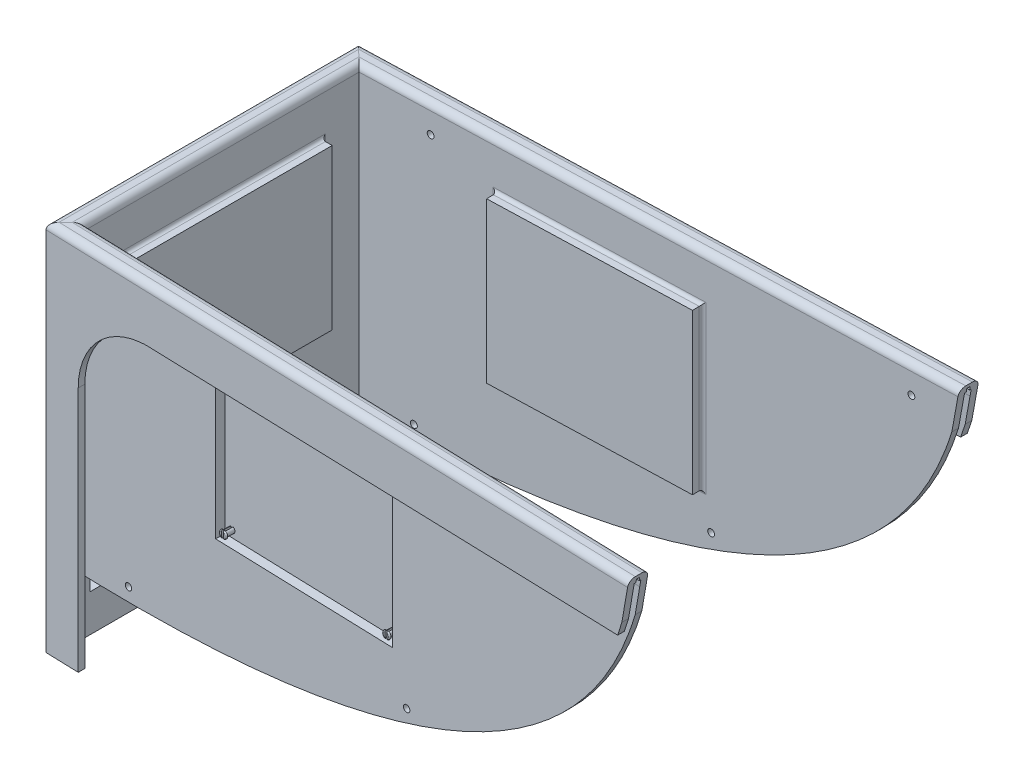
from build123d import *

# Parameters (mm, degrees)
FILETE2_R                   = 10
ESBO_O9_W                   = 300
ESBO_O9_H                   = 240
RESSALTO_EXTRUS_O3_DEPTH    = 15.25
FILETE5_R                   = 5
ESBO_O14_W                  = 300
ESBO_O14_H                  = 240
RESSALTO_EXTRUS_O4_DEPTH    = 15.25
ESBO_O15_W                  = 275
ESBO_O15_H                  = 214
CORTE_EXTRUS_O7_DEPTH       = 14
FILETE6_R                   = 5
ESBO_O10_W                  = 275
ESBO_O10_H                  = 214
CORTE_EXTRUS_O9_DEPTH       = 14
RESSALTO_EXTRUS_O5_DEPTH    = 480
FILETE7_R                   = 30
FILETE8_R                   = 110
ESBO_O18_W                  = 10
ESBO_O18_H                  = 50
RESSALTO_EXTRUS_O6_DEPTH    = 369.378390867
ESBO_O20_W                  = 300
ESBO_O20_H                  = 240
RESSALTO_EXTRUS_O7_DEPTH    = 15.25
ESBO_O19_W                  = 275
ESBO_O19_H                  = 214
CORTE_EXTRUS_O10_DEPTH      = 14
FILETE9_R                   = 5
CORTE_EXTRUS_O11_DEPTH      = 1125.95429238
CORTE_EXTRUS_O11_DEPTH_BACK = 1125.95429238
ESBO_O26_W                  = 79.384198275
ESBO_O26_H                  = 369.364957754
RESSALTO_EXTRUS_O11_DEPTH   = 58
CORTE_EXTRUS_O13_DEPTH      = 1036.72468391
CASCA5_START                = -484
CASCA5_DEPTH                = 46
CORTE_EXTRUS_O14_START      = -58
ESBO_O29_W                  = 24.384198275
ESBO_O29_H                  = 369.364957754
CORTE_EXTRUS_O14_DEPTH      = 58
ESBO_O31_W                  = 0.046067228
ESBO_O31_H                  = 369.364957754
RESSALTO_EXTRUS_O12_DEPTH   = 40
ESBO_O32_R                  = 8
CORTE_EXTRUS_O15_DEPTH      = 1119.047561812
ESBO_O35_R                  = 8
CORTE_EXTRUS_O17_DEPTH      = 40
ESBO_O41_R                  = 8
CORTE_EXTRUS_O19_DEPTH      = 1171.169791695
ESBO_O40_R                  = 8
CORTE_EXTRUS_O20_DEPTH      = 1120.776870047
ESBO_O39_R                  = 8
CORTE_EXTRUS_O21_DEPTH      = 1121.170482418
ESBO_O37_R                  = 8
CORTE_EXTRUS_O22_DEPTH      = 1120.7776345
ESBO_O38_R                  = 8
CORTE_EXTRUS_O23_DEPTH      = 1121.171300703
ESBO_O43_R                  = 4.5
RESSALTO_EXTRUS_O13_DEPTH   = 12
ESBO_O45_R                  = 6
RESSALTO_EXTRUS_O14_DEPTH   = 2
FILETE16_R                  = 2
CORTE_EXTRUS_O24_REACH      = 1155.853
ESBO_O46_W                  = 3
ESBO_O46_H                  = 16.786110424
ESBO_O46_H_2                = 18.249198164
ESBO_O47_R                  = 4.5
RESSALTO_EXTRUS_O15_DEPTH   = 12
ESBO_O48_R                  = 6
RESSALTO_EXTRUS_O16_DEPTH   = 2
FILETE17_R                  = 2
ESBO_O49_W                  = 3
ESBO_O49_H                  = 16.746916968
ESBO_O49_H_2                = 19.143752138
CORTE_EXTRUS_O25_DEPTH      = 14
ESBO_O50_R                  = 4.5
RESSALTO_EXTRUS_O17_DEPTH   = 12
ESBO_O51_R                  = 6
RESSALTO_EXTRUS_O18_DEPTH   = 2
FILETE18_R                  = 2
CORTE_EXTRUS_O26_REACH      = 1155.853
ESBO_O52_W                  = 3
ESBO_O52_H                  = 16.045822922
ESBO_O52_H_2                = 14.769055064
ESBO_O53_R                  = 4.5
RESSALTO_EXTRUS_O19_DEPTH   = 12
ESBO_O54_R                  = 6
RESSALTO_EXTRUS_O20_DEPTH   = 2
FILETE19_R                  = 2
CORTE_EXTRUS_O27_REACH      = 1070.757
ESBO_O55_W                  = 3
ESBO_O55_H                  = 18.155230036
ESBO_O55_H_2                = 15.630150612
ESBO_O55_H_3                = 14.353148996
ESBO_O55_H_4                = 16.995204258
ESBO_O59_W                  = 369.364957754
ESBO_O59_H                  = 40
CORTE_EXTRUS_O30_DEPTH      = 10
ESBO_O61_W                  = 10
ESBO_O61_H                  = 70
RESSALTO_EXTRUS_O22_DEPTH   = 369.378390867
FILETE23_R                  = 30
FILETE24_R                  = 30
CUT_EXTRUDE3_DEPTH          = 40
CUT_EXTRUDE3_DEPTH_BACK     = 25
SKETCH4_R                   = 5
CUT_EXTRUDE4_DEPTH          = 25
CUT_EXTRUDE4_DEPTH_BACK     = 25
SKETCH5_R                   = 5
SKETCH6_R                   = 5
CUT_EXTRUDE5_DEPTH          = 25


with BuildPart() as part:
    # Varredura2: sweep along a path in Esboço1
    with BuildLine(Plane(origin=(0, 0, 0), x_dir=(1, 0, 0), z_dir=(0, 1, 0))) as varredura2_path:
        Line((950, 255), (0, 225))
        Line((0, 225), (0, -225))
        Line((0, -225), (950, -255))
    # Esboço2 → Varredura2 (sweep)
    with BuildSketch(Plane.XY):
        Polygon((10, 0), (10, -430), (20, -430), (20, 20), (-10, 20), (-10, -60), (0, -60), (0, 0), (0, 10), (2.5, 10), (2.5, 15), (7.5, 15), (7.5, 10), (10, 10), align=None)
    sweep(path=varredura2_path.line, transition=Transition.RIGHT)

    # Filete2
    filete2_edges = [part.edges().sort_by_distance(p)[0] for p in [
        (20, 20, 0),
        (-10, 20, 0),
        (485.315632134, 20, 220.31578699),
        (485.315632134, 20, -220.31578699),
        (469.842183933, 20, -249.842106505),
        (469.842183933, 20, 249.842106505),
    ]]
    fillet(filete2_edges, radius=FILETE2_R)

    # Esboço9 → Ressalto-extrusão3 (add)
    with BuildSketch(Plane(origin=(-6.466920368, 0, 204.785811648), x_dir=(-0.9995017576572264, 0, -0.03156321339970188), z_dir=(0.03156321339970188, 0, -0.9995017576572264))):
        with Locations((-376.790918448, -170)):
            Rectangle(ESBO_O9_W, ESBO_O9_H)
    extrude(amount=RESSALTO_EXTRUS_O3_DEPTH)

    # Filete5
    filete5_edges = [part.edges().sort_by_distance(p)[0] for p in [
        (220.211001242, -170, 211.944061804),
        (370.136264891, -50, 216.678543814),
        (520.061528539, -170, 221.413025824),
        (370.136264891, -290, 216.678543814),
    ]]
    fillet(filete5_edges, radius=FILETE5_R)

    # Esboço14 → Ressalto-extrusão4 (add)
    with BuildSketch(Plane(origin=(-6.466920368, 0, -204.785811648), x_dir=(0.9995017576572264, 0, -0.03156321339970189), z_dir=(0.03156321339970189, 0, 0.9995017576572264))):
        with Locations((376.790918448, -170)):
            Rectangle(ESBO_O14_W, ESBO_O14_H)
    extrude(amount=RESSALTO_EXTRUS_O4_DEPTH)

    # Esboço15 → Corte-extrusão7 (cut)
    with BuildSketch(Plane(origin=(-6.782552502, 0, -214.780829224), x_dir=(-0.9995017576572264, 0, 0.03156321339970189), z_dir=(-0.03156321339970189, 0, -0.9995017576572264))):
        with Locations((-376.790918448, -170)):
            Rectangle(ESBO_O15_W, ESBO_O15_H)
    extrude(amount=-CORTE_EXTRUS_O7_DEPTH, mode=Mode.SUBTRACT)

    # Filete6
    filete6_edges = [part.edges().sort_by_distance(p)[0] for p in [
        (520.061528539, -170, -221.413025824),
        (370.136264891, -50, -216.678543814),
        (220.211001242, -170, -211.944061804),
        (370.136264891, -290, -216.678543814),
    ]]
    fillet(filete6_edges, radius=FILETE6_R)

    # Esboço10 → Corte-extrusão9 (cut)
    with BuildSketch(Plane(origin=(-6.782552502, 0, 214.780829224), x_dir=(0.9995017576572264, 0, 0.03156321339970188), z_dir=(-0.03156321339970188, 0, 0.9995017576572264))):
        with Locations((376.790918448, -170)):
            Rectangle(ESBO_O10_W, ESBO_O10_H)
    extrude(amount=-CORTE_EXTRUS_O9_DEPTH, mode=Mode.SUBTRACT)

    # Esboço17 → Ressalto-extrusão5 (add)
    with BuildSketch(Plane.XZ.offset(60)):
        Polygon((40, 236.268142802), (40, 226.263157895), (0, 225), (0, 184.689195433), (-10, 184.689195433), (-10, 234.689195433), align=None)
        Polygon((-10, -184.689195433), (-10, -234.689195433), (40, -236.268142802), (40, -226.263157895), (0, -225), (0, -184.689195433), align=None)
    extrude(amount=RESSALTO_EXTRUS_O5_DEPTH)

    # Filete7
    filete7_edges = [part.edges().sort_by_distance(p)[0] for p in [
        (-5, -60, 184.689195433),
        (-5, -60, -184.689195433),
    ]]
    fillet(filete7_edges, radius=FILETE7_R)

    # Filete8
    filete8_edges = [part.edges().sort_by_distance(p)[0] for p in [
        (40, -60, 231.265650348),
        (40, -60, -231.265650348),
    ]]
    fillet(filete8_edges, radius=FILETE8_R)

    # Esboço18 → Ressalto-extrusão6 (add)
    with BuildSketch(Plane(origin=(0, 0, 184.689195433), x_dir=(-1, 0, 0), z_dir=(0, 0, -1))):
        with Locations((5, -515)):
            Rectangle(ESBO_O18_W, ESBO_O18_H)
    extrude(amount=RESSALTO_EXTRUS_O6_DEPTH)

    # Esboço20 → Ressalto-extrusão7 (add)
    with BuildSketch(Plane(origin=(20, 0, 0), x_dir=(0, 0, -1), z_dir=(1, 0, 0))):
        with Locations((0, -170)):
            Rectangle(ESBO_O20_W, ESBO_O20_H)
    extrude(amount=RESSALTO_EXTRUS_O7_DEPTH)

    # Esboço19 → Corte-extrusão10 (cut)
    with BuildSketch(Plane.ZY.offset(-10)):
        with Locations((0, -170)):
            Rectangle(ESBO_O19_W, ESBO_O19_H)
    extrude(amount=-CORTE_EXTRUS_O10_DEPTH, mode=Mode.SUBTRACT)

    # Filete9
    filete9_edges = [part.edges().sort_by_distance(p)[0] for p in [
        (20, -170, -150),
        (20, -50, 0),
        (20, -170, 150),
        (20, -290, 0),
    ]]
    fillet(filete9_edges, radius=FILETE9_R)

    # Esboço21 → Corte-extrusão11 (cut, two sides: drawn at the far end of the back side and taken through both)
    with BuildSketch(Plane.XY.offset(-CORTE_EXTRUS_O11_DEPTH_BACK)):
        with BuildLine():
            Line((956.934998993, 377.169250079), (1160.857153911, 377.169250079))
            Line((1160.857153911, 377.169250079), (1160.857153911, -557.721657685))
            Line((1160.857153911, -557.721657685), (47.737792571, -557.721657685))
            Line((47.737792571, -557.721657685), (47.737792571, -430))
            add(Edge.make_bspline(
                [(47.737792571, -430), (766.687909368, -424.265370751), (883.376804682, -40)],
                knots=[0, 0, 0, 0.856241292, 0.856241292, 0.856241292], degree=2))
            Line((883.376804682, -40), (956.934998993, 377.169250079))
        make_face()
    extrude(amount=CORTE_EXTRUS_O11_DEPTH + CORTE_EXTRUS_O11_DEPTH_BACK, mode=Mode.SUBTRACT)

    # Esboço26 → Ressalto-extrusão11 (add)
    with BuildSketch(Plane(origin=(0, -490, 0), x_dir=(1, 0, 0), z_dir=(0, 1, 0))):
        with Locations((-15.307900862, -0.006716556)):
            Rectangle(ESBO_O26_W, ESBO_O26_H)
    extrude(amount=RESSALTO_EXTRUS_O11_DEPTH)

    # Esboço27 → Corte-extrusão13 (cut, through all)
    with BuildSketch(Plane(origin=(0, -432, 0), x_dir=(1, 0, 0), z_dir=(0, 1, 0))):
        Polygon((-55, 184.675762321), (-55, 24.993283444), (-50.186320514, 92.617350681), (-46.866252377, 142.507000385), (-20, 184.675762321), align=None)
        Polygon((-55, -184.689195433), (-20, -184.689195433), (-46.866252377, -142.520433498), (-50.186320514, -92.630783794), (-55, -25.006716556), align=None)
    extrude(amount=-CORTE_EXTRUS_O13_DEPTH, mode=Mode.SUBTRACT)

    # Casca5: read off the stored shape, not the designer's step
    # Casca5 outline → Casca5 (cut)
    with BuildSketch(Plane(origin=(0, 0, 0), x_dir=(1, 0, 0), z_dir=(0, 1, 0)).offset(CASCA5_START)):
        Polygon((24.384198275, 178.675762321), (-16.708405005, 178.675762321), (-40.981397022, 140.577332832), (-44.200481443, 92.205134579), (-49, 24.780004473), (-49, -24.793437586), (-44.200481443, -92.218567692), (-40.981397022, -140.590765945), (-16.708405005, -178.689195433), (24.384198275, -178.689195433), align=None)
    extrude(amount=CASCA5_DEPTH, mode=Mode.SUBTRACT)

    # Esboço29 → Corte-extrusão14 (cut)
    with BuildSketch(Plane.XZ.offset(490).offset(CORTE_EXTRUS_O14_START)):
        with Locations((12.192099138, 0.006716556)):
            Rectangle(ESBO_O29_W, ESBO_O29_H)
    extrude(amount=CORTE_EXTRUS_O14_DEPTH, mode=Mode.SUBTRACT)

    # Esboço31 → Ressalto-extrusão12 (add)
    with BuildSketch(Plane(origin=(0, -432, 0), x_dir=(1, 0, 0), z_dir=(0, 1, 0))):
        with Locations((-9.976966386, -0.006716556)):
            Rectangle(ESBO_O31_W, ESBO_O31_H)
    extrude(amount=RESSALTO_EXTRUS_O12_DEPTH)

    # Esboço32 → Corte-extrusão15 (cut, through all)
    with BuildSketch(Plane(origin=(-49, 0, 0), x_dir=(0, 0, -1), z_dir=(1, 0, 0))):
        with Locations((-13.581716556, -461)):
            Circle(ESBO_O32_R)
        with Locations((13.568283444, -461)):
            Circle(ESBO_O32_R)
    extrude(amount=-CORTE_EXTRUS_O15_DEPTH, mode=Mode.SUBTRACT)

    # Esboço35 → Corte-extrusão17 (cut)
    with BuildSketch(Plane(origin=(-92.860366617, 0, 59.162515826), x_dir=(-0.5373250475482975, 0, -0.8433752387147846), z_dir=(0.8433752387147846, 0, -0.5373250475482975))):
        with Locations((-105.562319013, -461)):
            Circle(ESBO_O35_R)
        with Locations((-132.712319013, -461)):
            Circle(ESBO_O35_R)
    extrude(amount=-CORTE_EXTRUS_O17_DEPTH, mode=Mode.SUBTRACT)

    # Esboço41 → Corte-extrusão19 (cut, through all)
    with BuildSketch(Plane(origin=(-92.854279179, 0, -59.158637442), x_dir=(0.5373250475483063, 0, -0.843375238714779), z_dir=(0.843375238714779, 0, 0.5373250475483063))):
        with Locations((105.550989859, -461)):
            Circle(ESBO_O41_R)
        with Locations((132.700989859, -461)):
            Circle(ESBO_O41_R)
    extrude(amount=-CORTE_EXTRUS_O19_DEPTH, mode=Mode.SUBTRACT)

    # Esboço40 → Corte-extrusão20 (cut, through all)
    with BuildSketch(Plane(origin=(-50.114629379, 0, -3.335040137), x_dir=(0.06640136272951913, 0, -0.9977929940762578), z_dir=(0.9977929940762578, 0, 0.06640136272951913))):
        with Locations((99.731261158, -461)):
            Circle(ESBO_O40_R)
        with Locations((126.881261158, -461)):
            Circle(ESBO_O40_R)
    extrude(amount=-CORTE_EXTRUS_O20_DEPTH, mode=Mode.SUBTRACT)

    # Esboço39 → Corte-extrusão21 (cut, through all)
    with BuildSketch(Plane(origin=(-50.507988926, 0, -3.595306821), x_dir=(0.07100327371981673, 0, -0.9974760824807124), z_dir=(0.9974760824807124, 0, 0.07100327371981673))):
        with Locations((41.461169458, -461)):
            Circle(ESBO_O39_R)
        with Locations((68.611169458, -461)):
            Circle(ESBO_O39_R)
    extrude(amount=-CORTE_EXTRUS_O21_DEPTH, mode=Mode.SUBTRACT)

    # Esboço37 → Corte-extrusão22 (cut, through all)
    with BuildSketch(Plane(origin=(-50.115519387, 0, 3.335099365), x_dir=(-0.06640136272951945, 0, -0.9977929940762577), z_dir=(0.9977929940762577, 0, -0.06640136272951945))):
        with Locations((-126.894664624, -461)):
            Circle(ESBO_O37_R)
        with Locations((-99.744664624, -461)):
            Circle(ESBO_O37_R)
    extrude(amount=-CORTE_EXTRUS_O22_DEPTH, mode=Mode.SUBTRACT)

    # Esboço38 → Corte-extrusão23 (cut, through all)
    with BuildSketch(Plane(origin=(-50.508940313, 0, 3.595374543), x_dir=(-0.07100327371981689, 0, -0.9974760824807123), z_dir=(0.9974760824807123, 0, -0.07100327371981689))):
        with Locations((-68.624568666, -461)):
            Circle(ESBO_O38_R)
        with Locations((-41.474568666, -461)):
            Circle(ESBO_O38_R)
    extrude(amount=-CORTE_EXTRUS_O23_DEPTH, mode=Mode.SUBTRACT)

    # Esboço43 → Ressalto-extrusão13 (add)
    with BuildSketch(Plane(origin=(-6.340667514, 0, 200.787804617), x_dir=(0.9995017576572264, 0, 0.03156321339970196), z_dir=(-0.03156321339970196, 0, 0.9995017576572264))):
        with Locations(Location((503.530918448, -266.34, 0), (0, 0, 180))):
            Circle(ESBO_O43_R)
        with Locations(Location((250.050918448, -266.34, 0), (0, 0, 180))):
            Circle(ESBO_O43_R)
    extrude(amount=RESSALTO_EXTRUS_O13_DEPTH)

    # Esboço45 → Ressalto-extrusão14 (add)
    with BuildSketch(Plane(origin=(-6.719426075, 0, 212.781825709), x_dir=(0.9995017576572264, 0, 0.03156321339970196), z_dir=(-0.03156321339970196, 0, 0.9995017576572264))):
        with Locations(Location((503.530918448, -266.34, 0), (0, 0, 180))):
            Circle(ESBO_O45_R)
        with Locations(Location((250.050918448, -266.34, 0), (0, 0, 180))):
            Circle(ESBO_O45_R)
    extrude(amount=RESSALTO_EXTRUS_O14_DEPTH)

    # Filete16
    filete16_edges = [part.edges().sort_by_distance(p)[0] for p in [
        (502.494496068, -266.34, 230.863262337),
        (249.140790537, -266.34, 222.862619005),
    ]]
    fillet(filete16_edges, radius=FILETE16_R - 0.0001)  # a hair under: the kernel refuses the full size

    # Corte-extrusão24: up to this face of the body (flat: up to its plane)
    corte_extrus_o24_end = Plane(part.part.faces().sort_by_distance((370.262517744, -169.791260308, 212.680536783))[0])
    # Esboço46 → Corte-extrusão24 (cut, up to the picked face)
    with BuildSketch(Plane(origin=(-6.782552502, 0, 214.780829224), x_dir=(0.9995017576572264, 0, 0.03156321339970196), z_dir=(-0.03156321339970196, 0, 0.9995017576572264)), mode=Mode.PRIVATE) as corte_extrus_o24_sk1:
        with Locations((250.050918448, -266.34)):
            Rectangle(ESBO_O46_W, ESBO_O46_H)
    corte_extrus_o24_tool1 = split(extrude(corte_extrus_o24_sk1.sketch, amount=-CORTE_EXTRUS_O24_REACH, mode=Mode.PRIVATE), bisect_by=corte_extrus_o24_end, keep=Keep.BOTH, mode=Mode.PRIVATE)
    # Esboço46 → Corte-extrusão24 (cut, up to the picked face)
    with BuildSketch(Plane(origin=(-6.782552502, 0, 214.780829224), x_dir=(0.9995017576572264, 0, 0.03156321339970196), z_dir=(-0.03156321339970196, 0, 0.9995017576572264)), mode=Mode.PRIVATE) as corte_extrus_o24_sk2:
        with Locations((503.530918448, -266.34)):
            Rectangle(ESBO_O46_W, ESBO_O46_H_2)
    corte_extrus_o24_tool2 = split(extrude(corte_extrus_o24_sk2.sketch, amount=-CORTE_EXTRUS_O24_REACH, mode=Mode.PRIVATE), bisect_by=corte_extrus_o24_end, keep=Keep.BOTH, mode=Mode.PRIVATE)
    add(corte_extrus_o24_tool1.solids().sort_by(Axis((243.14378, -266.34, 222.67324), (0.03156321339970196, 0, -0.9995017576572264)))[0], mode=Mode.SUBTRACT)
    add(corte_extrus_o24_tool2.solids().sort_by(Axis((496.497486, -266.34, 230.673883), (0.03156321339970196, 0, -0.9995017576572264)))[0], mode=Mode.SUBTRACT)

    # Esboço47 → Ressalto-extrusão15 (add)
    with BuildSketch(Plane(origin=(-6.340667514, 0, 200.787804617), x_dir=(0.9995017576572264, 0, 0.03156321339970196), z_dir=(-0.03156321339970196, 0, 0.9995017576572264))):
        with Locations(Location((250.050918448, -74.35, 0), (0, 0, 180))):
            Circle(ESBO_O47_R)
        with Locations(Location((503.530918448, -74.35, 0), (0, 0, 180))):
            Circle(ESBO_O47_R)
    extrude(amount=RESSALTO_EXTRUS_O15_DEPTH)

    # Esboço48 → Ressalto-extrusão16 (add)
    with BuildSketch(Plane(origin=(-6.719426075, 0, 212.781825709), x_dir=(0.9995017576572264, 0, 0.03156321339970196), z_dir=(-0.03156321339970196, 0, 0.9995017576572264))):
        with Locations(Location((250.050918448, -74.35, 0), (0, 0, 180))):
            Circle(ESBO_O48_R)
        with Locations(Location((503.530918448, -74.35, 0), (0, 0, 180))):
            Circle(ESBO_O48_R)
    extrude(amount=RESSALTO_EXTRUS_O16_DEPTH)

    # Filete17
    filete17_edges = [part.edges().sort_by_distance(p)[0] for p in [
        (249.140790537, -74.35, 222.862619005),
        (502.494496068, -74.35, 230.863262337),
    ]]
    fillet(filete17_edges, radius=FILETE17_R - 0.0001)  # a hair under: the kernel refuses the full size

    # Esboço49 → Corte-extrusão25 (cut)
    with BuildSketch(Plane(origin=(-6.782552502, 0, 214.780829224), x_dir=(0.9995017576572264, 0, 0.03156321339970196), z_dir=(-0.03156321339970196, 0, 0.9995017576572264))):
        with Locations((250.050918448, -74.35)):
            Rectangle(ESBO_O49_W, ESBO_O49_H)
        with Locations((503.530918448, -74.35)):
            Rectangle(ESBO_O49_W, ESBO_O49_H_2)
    extrude(amount=-CORTE_EXTRUS_O25_DEPTH, mode=Mode.SUBTRACT)

    # Esboço50 → Ressalto-extrusão17 (add)
    with BuildSketch(Plane(origin=(-6.340667514, 0, -200.787804617), x_dir=(-0.9995017576572264, 0, 0.03156321339970186), z_dir=(-0.03156321339970186, 0, -0.9995017576572264))):
        with Locations(Location((-503.530918448, -266.34, 0), (0, 0, 180))):
            Circle(ESBO_O50_R)
        with Locations(Location((-250.050918448, -266.34, 0), (0, 0, 180))):
            Circle(ESBO_O50_R)
        with Locations(Location((-503.530918448, -74.35, 0), (0, 0, 180))):
            Circle(ESBO_O50_R)
        with Locations(Location((-250.050918448, -74.35, 0), (0, 0, 180))):
            Circle(ESBO_O50_R)
    extrude(amount=RESSALTO_EXTRUS_O17_DEPTH)

    # Esboço51 → Ressalto-extrusão18 (add)
    with BuildSketch(Plane(origin=(-6.719426075, 0, -212.781825709), x_dir=(-0.9995017576572264, 0, 0.03156321339970186), z_dir=(-0.03156321339970186, 0, -0.9995017576572264))):
        with Locations(Location((-503.530918448, -266.34, 0), (0, 0, 180))):
            Circle(ESBO_O51_R)
        with Locations(Location((-250.050918448, -266.34, 0), (0, 0, 180))):
            Circle(ESBO_O51_R)
        with Locations(Location((-250.050918448, -74.35, 0), (0, 0, 180))):
            Circle(ESBO_O51_R)
        with Locations(Location((-503.530918448, -74.35, 0), (0, 0, 180))):
            Circle(ESBO_O51_R)
    extrude(amount=RESSALTO_EXTRUS_O18_DEPTH)

    # Filete18
    filete18_edges = [part.edges().sort_by_distance(p)[0] for p in [
        (490.500474976, -266.34, -230.484503776),
        (237.146769445, -266.34, -222.483860444),
        (237.146769445, -74.35, -222.483860444),
        (490.500474976, -74.35, -230.484503776),
    ]]
    fillet(filete18_edges, radius=FILETE18_R - 0.0001)  # a hair under: the kernel refuses the full size

    # Corte-extrusão26: up to this face of the body (flat: up to its plane)
    corte_extrus_o26_end = Plane(part.part.faces().sort_by_distance((370.262517744, -169.998501732, -212.680536783))[0])
    # Esboço52 → Corte-extrusão26 (cut, up to the picked face)
    with BuildSketch(Plane(origin=(-6.782552502, 0, -214.780829224), x_dir=(-0.9995017576572264, 0, 0.03156321339970186), z_dir=(-0.03156321339970186, 0, -0.9995017576572264)), mode=Mode.PRIVATE) as corte_extrus_o26_sk1:
        with Locations((-503.530918448, -266.34)):
            Rectangle(ESBO_O52_W, ESBO_O52_H)
    corte_extrus_o26_tool1 = split(extrude(corte_extrus_o26_sk1.sketch, amount=-CORTE_EXTRUS_O26_REACH, mode=Mode.PRIVATE), bisect_by=corte_extrus_o26_end, keep=Keep.BOTH, mode=Mode.PRIVATE)
    # Esboço52 → Corte-extrusão26 (cut, up to the picked face)
    with BuildSketch(Plane(origin=(-6.782552502, 0, -214.780829224), x_dir=(-0.9995017576572264, 0, 0.03156321339970186), z_dir=(-0.03156321339970186, 0, -0.9995017576572264)), mode=Mode.PRIVATE) as corte_extrus_o26_sk2:
        with Locations((-250.050918448, -266.34)):
            Rectangle(ESBO_O52_W, ESBO_O52_H)
    corte_extrus_o26_tool2 = split(extrude(corte_extrus_o26_sk2.sketch, amount=-CORTE_EXTRUS_O26_REACH, mode=Mode.PRIVATE), bisect_by=corte_extrus_o26_end, keep=Keep.BOTH, mode=Mode.PRIVATE)
    # Esboço52 → Corte-extrusão26 (cut, up to the picked face)
    with BuildSketch(Plane(origin=(-6.782552502, 0, -214.780829224), x_dir=(-0.9995017576572264, 0, 0.03156321339970186), z_dir=(-0.03156321339970186, 0, -0.9995017576572264)), mode=Mode.PRIVATE) as corte_extrus_o26_sk3:
        with Locations((-250.050918448, -74.35)):
            Rectangle(ESBO_O52_W, ESBO_O52_H_2)
    corte_extrus_o26_tool3 = split(extrude(corte_extrus_o26_sk3.sketch, amount=-CORTE_EXTRUS_O26_REACH, mode=Mode.PRIVATE), bisect_by=corte_extrus_o26_end, keep=Keep.BOTH, mode=Mode.PRIVATE)
    # Esboço52 → Corte-extrusão26 (cut, up to the picked face)
    with BuildSketch(Plane(origin=(-6.782552502, 0, -214.780829224), x_dir=(-0.9995017576572264, 0, 0.03156321339970186), z_dir=(-0.03156321339970186, 0, -0.9995017576572264)), mode=Mode.PRIVATE) as corte_extrus_o26_sk4:
        with Locations((-503.530918448, -74.35)):
            Rectangle(ESBO_O52_W, ESBO_O52_H_2)
    corte_extrus_o26_tool4 = split(extrude(corte_extrus_o26_sk4.sketch, amount=-CORTE_EXTRUS_O26_REACH, mode=Mode.PRIVATE), bisect_by=corte_extrus_o26_end, keep=Keep.BOTH, mode=Mode.PRIVATE)
    add(corte_extrus_o26_tool1.solids().sort_by(Axis((496.497486, -266.34, -230.673883), (0.03156321339970186, 0, 0.9995017576572264)))[0], mode=Mode.SUBTRACT)
    add(corte_extrus_o26_tool2.solids().sort_by(Axis((243.14378, -266.34, -222.67324), (0.03156321339970186, 0, 0.9995017576572264)))[0], mode=Mode.SUBTRACT)
    add(corte_extrus_o26_tool3.solids().sort_by(Axis((243.14378, -74.35, -222.67324), (0.03156321339970186, 0, 0.9995017576572264)))[0], mode=Mode.SUBTRACT)
    add(corte_extrus_o26_tool4.solids().sort_by(Axis((496.497486, -74.35, -230.673883), (0.03156321339970186, 0, 0.9995017576572264)))[0], mode=Mode.SUBTRACT)

    # Esboço53 → Ressalto-extrusão19 (add)
    with BuildSketch(Plane.ZY.offset(-24)):
        with Locations(Location((-126.74, -266.34, 0), (0, 0, 180))):
            Circle(ESBO_O53_R)
        with Locations(Location((126.74, -266.34, 0), (0, 0, 180))):
            Circle(ESBO_O53_R)
        with Locations(Location((-126.74, -74.35, 0), (0, 0, 180))):
            Circle(ESBO_O53_R)
        with Locations(Location((126.74, -74.35, 0), (0, 0, 180))):
            Circle(ESBO_O53_R)
    extrude(amount=RESSALTO_EXTRUS_O19_DEPTH)

    # Esboço54 → Ressalto-extrusão20 (add)
    with BuildSketch(Plane.ZY.offset(-12)):
        with Locations((-126.74, -266.34)):
            Circle(ESBO_O54_R)
        with Locations((126.74, -266.34)):
            Circle(ESBO_O54_R)
        with Locations((126.74, -74.35)):
            Circle(ESBO_O54_R)
        with Locations((-126.74, -74.35)):
            Circle(ESBO_O54_R)
    extrude(amount=RESSALTO_EXTRUS_O20_DEPTH)

    # Filete19
    filete19_edges = [part.edges().sort_by_distance(p)[0] for p in [
        (10, -266.34, -132.74),
        (10, -266.34, 120.74),
        (10, -74.35, 120.74),
        (10, -74.35, -132.74),
    ]]
    fillet(filete19_edges, radius=FILETE19_R - 0.0001)  # a hair under: the kernel refuses the full size

    # Corte-extrusão27: up to this face of the body (flat: up to its plane)
    corte_extrus_o27_end = Plane(part.part.faces().sort_by_distance((24, -169.998501732, 0))[0])
    # Esboço55 → Corte-extrusão27 (cut, up to the picked face)
    with BuildSketch(Plane.ZY.offset(-10), mode=Mode.PRIVATE) as corte_extrus_o27_sk1:
        with Locations((-126.74, -266.34)):
            Rectangle(ESBO_O55_W, ESBO_O55_H)
    corte_extrus_o27_tool1 = split(extrude(corte_extrus_o27_sk1.sketch, amount=-CORTE_EXTRUS_O27_REACH, mode=Mode.PRIVATE), bisect_by=corte_extrus_o27_end, keep=Keep.BOTH, mode=Mode.PRIVATE)
    # Esboço55 → Corte-extrusão27 (cut, up to the picked face)
    with BuildSketch(Plane.ZY.offset(-10), mode=Mode.PRIVATE) as corte_extrus_o27_sk2:
        with Locations((126.74, -266.34)):
            Rectangle(ESBO_O55_W, ESBO_O55_H_2)
    corte_extrus_o27_tool2 = split(extrude(corte_extrus_o27_sk2.sketch, amount=-CORTE_EXTRUS_O27_REACH, mode=Mode.PRIVATE), bisect_by=corte_extrus_o27_end, keep=Keep.BOTH, mode=Mode.PRIVATE)
    # Esboço55 → Corte-extrusão27 (cut, up to the picked face)
    with BuildSketch(Plane.ZY.offset(-10), mode=Mode.PRIVATE) as corte_extrus_o27_sk3:
        with Locations((126.74, -74.35)):
            Rectangle(ESBO_O55_W, ESBO_O55_H_3)
    corte_extrus_o27_tool3 = split(extrude(corte_extrus_o27_sk3.sketch, amount=-CORTE_EXTRUS_O27_REACH, mode=Mode.PRIVATE), bisect_by=corte_extrus_o27_end, keep=Keep.BOTH, mode=Mode.PRIVATE)
    # Esboço55 → Corte-extrusão27 (cut, up to the picked face)
    with BuildSketch(Plane.ZY.offset(-10), mode=Mode.PRIVATE) as corte_extrus_o27_sk4:
        with Locations((-126.74, -74.35)):
            Rectangle(ESBO_O55_W, ESBO_O55_H_4)
    corte_extrus_o27_tool4 = split(extrude(corte_extrus_o27_sk4.sketch, amount=-CORTE_EXTRUS_O27_REACH, mode=Mode.PRIVATE), bisect_by=corte_extrus_o27_end, keep=Keep.BOTH, mode=Mode.PRIVATE)
    add(corte_extrus_o27_tool1.solids().sort_by(Axis((10, -266.34, -126.74), (1, 0, 0)))[0], mode=Mode.SUBTRACT)
    add(corte_extrus_o27_tool2.solids().sort_by(Axis((10, -266.34, 126.74), (1, 0, 0)))[0], mode=Mode.SUBTRACT)
    add(corte_extrus_o27_tool3.solids().sort_by(Axis((10, -74.35, 126.74), (1, 0, 0)))[0], mode=Mode.SUBTRACT)
    add(corte_extrus_o27_tool4.solids().sort_by(Axis((10, -74.35, -126.74), (1, 0, 0)))[0], mode=Mode.SUBTRACT)

    # Esboço59 → Corte-extrusão30 (cut)
    with BuildSketch(Plane.ZY.offset(10)):
        with Locations((0.006716556, -412)):
            Rectangle(ESBO_O59_W, ESBO_O59_H)
    extrude(amount=-CORTE_EXTRUS_O30_DEPTH, mode=Mode.SUBTRACT)

    # Esboço61 → Ressalto-extrusão22 (add)
    with BuildSketch(Plane.XY.offset(-184.689195433)):
        with Locations((-5, -397)):
            Rectangle(ESBO_O61_W, ESBO_O61_H)
    extrude(amount=RESSALTO_EXTRUS_O22_DEPTH)

    # Filete23
    filete23_edges = [part.edges().sort_by_distance(p)[0] for p in [
        (-5, -362, -184.689195433),
        (-5, -362, 184.689195434),
    ]]
    fillet(filete23_edges, radius=FILETE23_R)

    # Filete24
    # the kernel refuses this fillet: 30 mm, written as the material it adds along each edge
    with BuildSketch(Plane(origin=(-10, -490, 184.689195433), x_dir=(0, -1, 0), z_dir=(0, 0, -1))) as filete24_piece_1_section:
        with BuildLine():
            CenterArc((FILETE24_R, FILETE24_R), FILETE24_R, 180, 90)
            Line((0, FILETE24_R), (0, 0))
            Line((0, 0), (FILETE24_R, 0))
        make_face()
    filete24_piece_1 = extrude(amount=369.364957754, mode=Mode.PRIVATE)
    filete24_piece_1 = split(filete24_piece_1, bisect_by=Plane(origin=(-184.496694862, -490, 73.515140802), z_dir=(0.843375238714779, 0, 0.5373250475483063)), keep=Keep.TOP, mode=Mode.PRIVATE)
    filete24_piece_1 = split(filete24_piece_1, bisect_by=Plane(origin=(-17.112817933, -490, 189.220861836), z_dir=(0.8433752387147847, 0, -0.5373250475482972)), keep=Keep.TOP, mode=Mode.PRIVATE)
    add(filete24_piece_1)
    with BuildSketch(Plane(origin=(-10, -432, -184.675762321), x_dir=(0, 1, 0), z_dir=(0, 0, 1))) as filete24_piece_2_section:
        with BuildLine():
            CenterArc((FILETE24_R, FILETE24_R), FILETE24_R, 180, 90)
            Line((0, FILETE24_R), (0, 0))
            Line((0, 0), (FILETE24_R, 0))
        make_face()
    filete24_piece_2 = extrude(amount=369.364957755, mode=Mode.PRIVATE)
    filete24_piece_2 = split(filete24_piece_2, bisect_by=Plane(origin=(-17.112817933, -432, -189.207428723), z_dir=(0.843375238714779, 0, 0.5373250475483063)), keep=Keep.TOP, mode=Mode.PRIVATE)
    filete24_piece_2 = split(filete24_piece_2, bisect_by=Plane(origin=(-184.496694862, -432, -73.501707689), z_dir=(0.8433752387147847, 0, -0.5373250475482972)), keep=Keep.TOP, mode=Mode.PRIVATE)
    add(filete24_piece_2)

    # Sketch4 → Cut-Extrude3 (cut, two sides: drawn at the far end of the back side and taken through both)
    with BuildSketch(Plane(origin=(-6.466920368, 0, -204.785811648), x_dir=(0.9995017576572264, 0, -0.031563213399701896), z_dir=(0.031563213399701896, 0, 0.9995017576572264)).offset(-CUT_EXTRUDE3_DEPTH_BACK)):
        with Locations(Location((831.329971494, -20.954044031, 0), (0, 0, 180))):
            Circle(SKETCH4_R)
        with Locations(Location((130.82496917, -20.954044031, 0), (0, 0, 180))):
            Circle(SKETCH4_R)
    extrude(amount=CUT_EXTRUDE3_DEPTH + CUT_EXTRUDE3_DEPTH_BACK, mode=Mode.SUBTRACT)

    # Sketch5 → Cut-Extrude4 (cut, two sides: drawn at the far end of the back side and taken through both)
    with BuildSketch(Plane(origin=(-6.466920368, 0, 204.785811648), x_dir=(-0.9995017576572264, 0, -0.03156321339970189), z_dir=(0.03156321339970189, 0, -0.9995017576572264)).offset(-CUT_EXTRUDE4_DEPTH_BACK)):
        with Locations(Location((-824.020773171, -14.634112023, 0), (0, 0, 180))):
            Circle(SKETCH5_R)
        with Locations(Location((-122.69364293, -14.634112023, 0), (0, 0, 180))):
            Circle(SKETCH5_R)
        with Locations(Location((-535.874080329, -344.961211281, 0), (0, 0, 180))):
            Circle(SKETCH5_R)
        with Locations(Location((-104.164608125, -409.127183318, 0), (0, 0, 180))):
            Circle(SKETCH5_R)
    extrude(amount=CUT_EXTRUDE4_DEPTH + CUT_EXTRUDE4_DEPTH_BACK, mode=Mode.SUBTRACT)

    # Sketch6 → Cut-Extrude5 (cut)
    with BuildSketch(Plane(origin=(-6.466920368, 0, -204.785811648), x_dir=(0.9995017576572264, 0, -0.031563213399701896), z_dir=(0.031563213399701896, 0, 0.9995017576572264))):
        with Locations((539.529074406, -340.958403049)):
            Circle(SKETCH6_R)
        with Locations((106.385789815, -409.688346208)):
            Circle(SKETCH6_R)
    extrude(amount=-CUT_EXTRUDE5_DEPTH, mode=Mode.SUBTRACT)


solid = part.part
